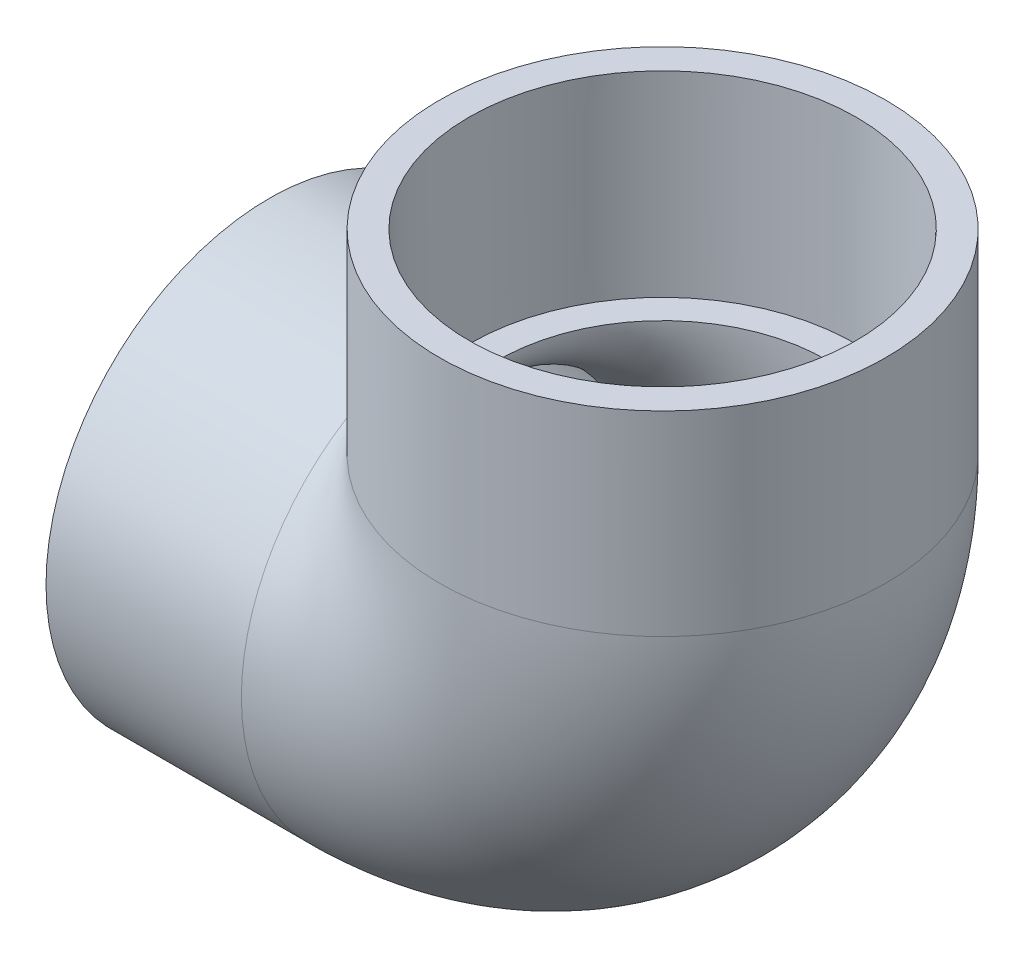
from build123d import *

# Parameters (mm, degrees)
SKETCH3_R   = 66.1416
SKETCH3_R_2 = 48.5902


with BuildPart() as part:
    # Sketch1 → Revolve1 (revolve)
    with BuildSketch(Plane.XY):
        Polygon((-116.6368, -66.1416), (-58.7248, -66.1416), (-58.7248, -57.0357), (-116.6368, -57.3786), align=None)
    revolve(axis=Axis((-116.6368, 0, 0), (1, 0, 0)))


with BuildPart() as body_2:
    # Sketch2 → Revolve2 (revolve)
    with BuildSketch(Plane.XY):
        Polygon((57.3786, 116.6368), (57.0357, 58.7248), (66.1416, 58.7248), (66.1416, 116.6368), align=None)
    revolve(axis=Axis((0, 0, 0), (0, 1, 0)))


with BuildPart() as sweep1_tool:
    # Sweep1: sweep along a path in Sketch4
    with BuildLine(Plane.XY) as sweep1_path:
        ThreePointArc((-58.7248, 0), (-17.200096, 17.200096), (0, 58.7248))
    # Sketch3 → Sweep1 (sweep)
    with BuildSketch(Plane(origin=(-58.7248, 0, 0), x_dir=(0, 0, -1), z_dir=(1, 0, 0))):
        Circle(SKETCH3_R)
        Circle(SKETCH3_R_2, mode=Mode.SUBTRACT)
    sweep(path=sweep1_path.line)


with BuildPart() as part_1:
    add(part.part)


with BuildPart() as part_2:
    # Sweep1: joined with sweep1_tool
    add(part_1.part.fuse(sweep1_tool.part, body_2.part, tol=0.00001))


solid = part_2.part
